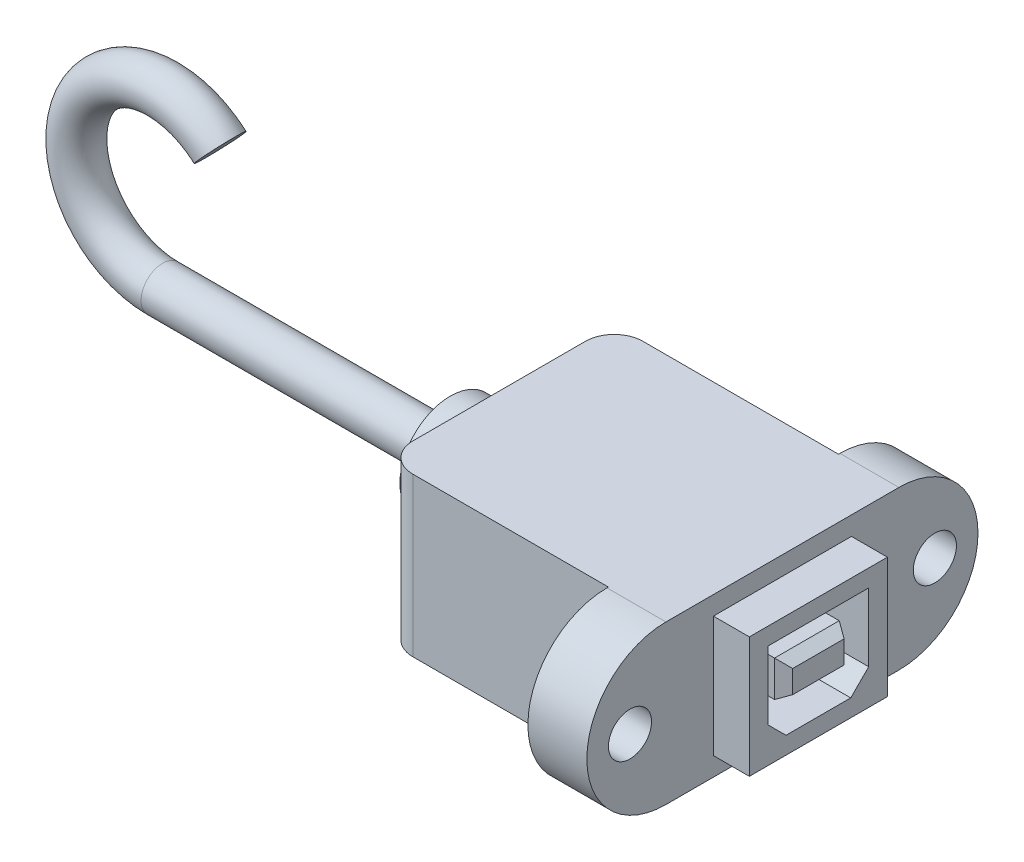
from build123d import *
from OCP.BRepFilletAPI import BRepFilletAPI_MakeChamfer

# Parameters (mm, degrees)
BOSS_EXTRUDE1_DEPTH = 13.97
SKETCH2_W           = 12.192
SKETCH2_H           = 10.668
BOSS_EXTRUDE2_DEPTH = 3.175
SKETCH3_W           = 5.715
SKETCH3_H           = 3.175
CUT_EXTRUDE1_DEPTH  = 7.62
CHAMFER1_SIZE       = 1.016
CHAMFER1_SIZE2      = 0.586587873
SKETCH4_R           = 1.905
CUT_EXTRUDE2_DEPTH  = 40.668953667
FILLET1_R           = 2.54
SKETCH5_R           = 4.445
BOSS_EXTRUDE3_DEPTH = 4.318
SKETCH6_R           = 1.905


with BuildPart() as part:
    # Sketch1 → Boss-Extrude1 (new body)
    with BuildSketch(Plane(origin=(0, 0, 0), x_dir=(1, 0, 0), z_dir=(0, 1, 0))):
        Polygon((0, 0), (0, 20.32), (19.812, 20.32), (19.812, 27.432), (25.019, 27.432), (25.019, -7.112), (19.812, -7.112), (19.812, 0), align=None)
    extrude(amount=BOSS_EXTRUDE1_DEPTH)

    # Sketch2 → Boss-Extrude2 (add)
    with BuildSketch(Plane(origin=(25.019, 0, 0), x_dir=(0, 0, -1), z_dir=(1, 0, 0))):
        with Locations((10.16, 6.985)):
            Rectangle(SKETCH2_W, SKETCH2_H)
    extrude(amount=BOSS_EXTRUDE2_DEPTH)

    # Sketch3 → Cut-Extrude1 (cut)
    with BuildSketch(Plane(origin=(28.194, 0, 0), x_dir=(0, 0, -1), z_dir=(1, 0, 0))):
        Polygon((5.715, 10.795), (14.605, 10.795), (14.605, 4.7625), (13.0175, 3.175), (7.3025, 3.175), (5.715, 4.7625), align=None)
        with Locations((10.16, 6.985)):
            Rectangle(SKETCH3_W, SKETCH3_H, mode=Mode.SUBTRACT)
    extrude(amount=-CUT_EXTRUDE1_DEPTH, mode=Mode.SUBTRACT)

    # Chamfer1: one chamfer whose edges measure the first distance from different faces: ONE call of the kernel's chamfer builder (chamfer() names one face for all edges)
    chamfer1_edges_1 = [part.edges().sort_by_distance(p)[0] for p in [
        (28.194, 6.985, -13.0175),
    ]]
    chamfer1_side_1 = [part.faces().sort_by_distance(p)[0] for p in [
        (24.384, 6.985, -13.0175),
    ]]
    chamfer1_edges_2 = [part.edges().sort_by_distance(p)[0] for p in [
        (28.194, 5.3975, -10.16),
    ]]
    chamfer1_side_2 = [part.faces().sort_by_distance(p)[0] for p in [
        (24.384, 5.3975, -10.16),
    ]]
    chamfer1_edges_3 = [part.edges().sort_by_distance(p)[0] for p in [
        (28.194, 6.985, -7.3025),
    ]]
    chamfer1_side_3 = [part.faces().sort_by_distance(p)[0] for p in [
        (24.384, 6.985, -7.3025),
    ]]
    chamfer1_edges_4 = [part.edges().sort_by_distance(p)[0] for p in [
        (28.194, 8.5725, -10.16),
    ]]
    chamfer1_side_4 = [part.faces().sort_by_distance(p)[0] for p in [
        (24.384, 8.5725, -10.16),
    ]]
    chamfer1 = BRepFilletAPI_MakeChamfer(part.part.solid().wrapped)
    for e in chamfer1_edges_1:
        chamfer1.Add(CHAMFER1_SIZE, CHAMFER1_SIZE2, e.wrapped, chamfer1_side_1[0].wrapped)  # the first distance lies on this face
    for e in chamfer1_edges_2:
        chamfer1.Add(CHAMFER1_SIZE, CHAMFER1_SIZE2, e.wrapped, chamfer1_side_2[0].wrapped)  # the first distance lies on this face
    for e in chamfer1_edges_3:
        chamfer1.Add(CHAMFER1_SIZE, CHAMFER1_SIZE2, e.wrapped, chamfer1_side_3[0].wrapped)  # the first distance lies on this face
    for e in chamfer1_edges_4:
        chamfer1.Add(CHAMFER1_SIZE, CHAMFER1_SIZE2, e.wrapped, chamfer1_side_4[0].wrapped)  # the first distance lies on this face
    add(Compound.cast(chamfer1.Shape()), mode=Mode.REPLACE)

    # Sketch4 → Cut-Extrude2 (cut, through all)
    with BuildSketch(Plane(origin=(25.019, 0, 0), x_dir=(0, 0, -1), z_dir=(1, 0, 0))):
        with BuildLine():
            Line((-7.112, 0), (-0.127, 0))
            ThreePointArc((-0.127, 0), (-5.06614087, 2.045859136), (-7.112, 6.985000009))
            Line((-7.112, 6.985000009), (-7.112, 0))
        make_face()
        with BuildLine():
            Line((-7.112, 13.97), (-7.112, 6.985000009))
            ThreePointArc((-7.112, 6.985000009), (-5.066140864, 11.92414087), (-0.127, 13.97))
            Line((-0.127, 13.97), (-7.112, 13.97))
        make_face()
        with BuildLine():
            ThreePointArc((27.432, 6.985), (25.386140867, 2.045859133), (20.447, 0))
            Line((20.447, 0), (27.432, 0))
            Line((27.432, 0), (27.432, 6.985))
        make_face()
        with BuildLine():
            ThreePointArc((20.447, 13.97), (25.386140867, 11.924140867), (27.432, 6.985))
            Line((27.432, 6.985), (27.432, 13.97))
            Line((27.432, 13.97), (20.447, 13.97))
        make_face()
        with Locations((-3.302, 6.985)):
            Circle(SKETCH4_R)
        with Locations((23.622, 6.985)):
            Circle(SKETCH4_R)
    extrude(amount=-CUT_EXTRUDE2_DEPTH, mode=Mode.SUBTRACT)

    # Fillet1
    fillet1_edges = [part.edges().sort_by_distance(p)[0] for p in [
        (0, 6.985, 0),
        (0, 6.985, -20.32),
    ]]
    fillet(fillet1_edges, radius=FILLET1_R)

    # Sketch5 → Boss-Extrude3 (add)
    with BuildSketch(Plane.ZY):
        with Locations((-10.16, 6.985)):
            Circle(SKETCH5_R)
    extrude(amount=BOSS_EXTRUDE3_DEPTH)

    # Sweep1: sweep along a path in Sketch7
    with BuildLine(Plane(origin=(0, 0, -10.16), x_dir=(-1, 0, 0), z_dir=(0, 0, -1))) as sweep1_path:
        Line((4.318, 6.985), (29.718, 6.985))
        ThreePointArc((29.718, 6.985), (36.836393375, 17.323984324), (24.638, 20.284612663))
    # Sketch6 → Sweep1 (sweep)
    with BuildSketch(Plane.ZY.offset(4.318)):
        with Locations((-10.16, 6.985)):
            Circle(SKETCH6_R)
    sweep(path=sweep1_path.line)


solid = part.part
